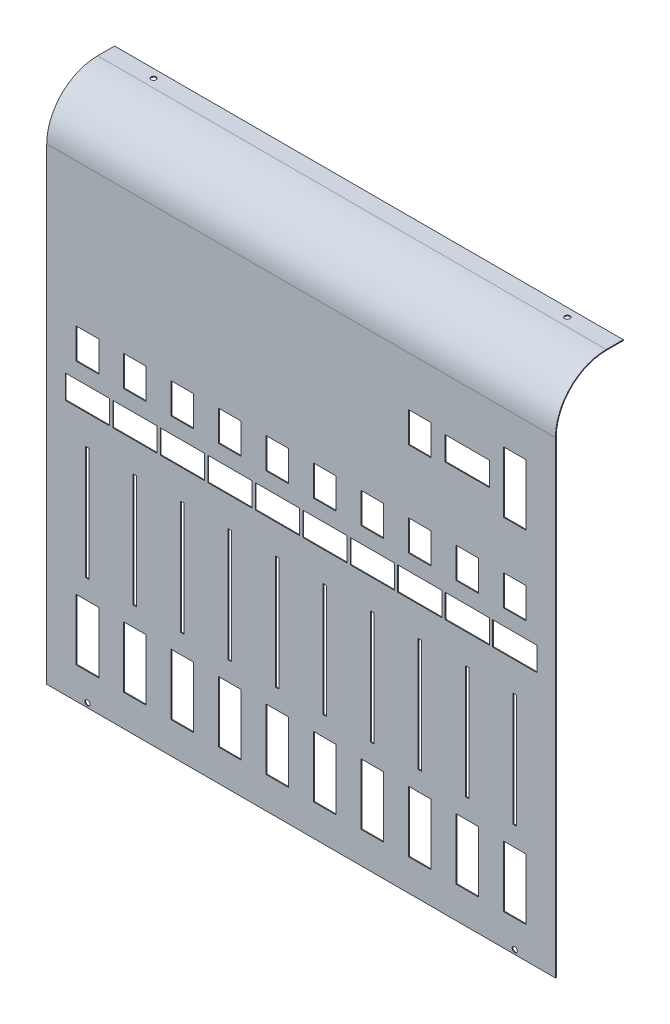
from build123d import *

# Parameters (mm, degrees)
SKETCH1_W           = 300
SKETCH1_H           = 210
SKETCH1_W_2         = 2
SKETCH1_H_2         = 67
SKETCH1_W_3         = 12.35
SKETCH1_H_3         = 17
SKETCH1_H_4         = 35
SKETCH1_W_4         = 25
SKETCH1_H_5         = 13
BOSS_EXTRUDE1_DEPTH = 0.5
SKETCH3_W           = 300
SKETCH3_H           = 66
SKETCH3_W_2         = 25
SKETCH3_H_2         = 13
SKETCH3_W_3         = 12.35
SKETCH3_H_3         = 35
BOSS_EXTRUDE2_DEPTH = 0.5
BOSS_EXTRUDE3_START = -300
BOSS_EXTRUDE3_DEPTH = 300
SKETCH13_W          = 12.35
SKETCH13_H          = 3.584384634
CUT_EXTRUDE4_DEPTH  = 15
SKETCH14_W          = 12.35
SKETCH14_H          = 17
CUT_EXTRUDE5_DEPTH  = 10
SKETCH15_W          = 12.35
SKETCH15_H          = 35
SKETCH15_W_2        = 13.35
SKETCH15_H_2        = 36
CUT_EXTRUDE6_DEPTH  = 10
SKETCH16_W          = 25
SKETCH16_H          = 13
CUT_EXTRUDE7_DEPTH  = 10
SKETCH17_W          = 12.35
SKETCH17_H          = 35
SKETCH17_H_2        = 17
CUT_EXTRUDE8_DEPTH  = 10
SKETCH18_W          = 13
SKETCH18_H          = 7
CUT_EXTRUDE9_DEPTH  = 10
SKETCH19_W          = 25
SKETCH19_H          = 1.257592029
BOSS_EXTRUDE7_DEPTH = 0.5
BOSS_EXTRUDE8_DEPTH = 0.5
CUT_EXTRUDE10_DEPTH = 433
BOSS_EXTRUDE9_DEPTH = 300
CUT_EXTRUDE11_DEPTH = 10
SKETCH24_R          = 1.5
CUT_EXTRUDE12_DEPTH = 10


# Read off the part's stored shape, not the designer's step: Boss-Extrude3
with BuildPart() as part:
    # Sketch1 → Boss-Extrude1 (new body)
    with BuildSketch(Plane.XY):
        with Locations((140, 95)):
            Rectangle(SKETCH1_W, SKETCH1_H)
        with Locations((42, 89.5)):
            Rectangle(SKETCH1_W_2, SKETCH1_H_2, mode=Mode.SUBTRACT)
        with Locations((14.01, 172.725)):
            Rectangle(SKETCH1_W_3, SKETCH1_H_3, mode=Mode.SUBTRACT)
        with Locations((42.01, 172.725)):
            Rectangle(SKETCH1_W_3, SKETCH1_H_3, mode=Mode.SUBTRACT)
        with Locations((70.01, 172.725)):
            Rectangle(SKETCH1_W_3, SKETCH1_H_3, mode=Mode.SUBTRACT)
        with Locations((98.01, 172.725)):
            Rectangle(SKETCH1_W_3, SKETCH1_H_3, mode=Mode.SUBTRACT)
        with Locations((126.01, 172.725)):
            Rectangle(SKETCH1_W_3, SKETCH1_H_3, mode=Mode.SUBTRACT)
        with Locations((154.01, 172.725)):
            Rectangle(SKETCH1_W_3, SKETCH1_H_3, mode=Mode.SUBTRACT)
        with Locations((182.01, 172.725)):
            Rectangle(SKETCH1_W_3, SKETCH1_H_3, mode=Mode.SUBTRACT)
        with Locations((210.01, 172.725)):
            Rectangle(SKETCH1_W_3, SKETCH1_H_3, mode=Mode.SUBTRACT)
        with Locations((238.01, 172.725)):
            Rectangle(SKETCH1_W_3, SKETCH1_H_3, mode=Mode.SUBTRACT)
        with Locations((266.01, 172.725)):
            Rectangle(SKETCH1_W_3, SKETCH1_H_3, mode=Mode.SUBTRACT)
        with Locations((14.01, 26.625)):
            Rectangle(SKETCH1_W_3, SKETCH1_H_4, mode=Mode.SUBTRACT)
        with Locations((42.01, 26.625)):
            Rectangle(SKETCH1_W_3, SKETCH1_H_4, mode=Mode.SUBTRACT)
        with Locations((70.01, 26.625)):
            Rectangle(SKETCH1_W_3, SKETCH1_H_4, mode=Mode.SUBTRACT)
        with Locations((98.01, 26.625)):
            Rectangle(SKETCH1_W_3, SKETCH1_H_4, mode=Mode.SUBTRACT)
        with Locations((126.01, 26.625)):
            Rectangle(SKETCH1_W_3, SKETCH1_H_4, mode=Mode.SUBTRACT)
        with Locations((154.01, 26.625)):
            Rectangle(SKETCH1_W_3, SKETCH1_H_4, mode=Mode.SUBTRACT)
        with Locations((182.01, 26.625)):
            Rectangle(SKETCH1_W_3, SKETCH1_H_4, mode=Mode.SUBTRACT)
        with Locations((210.01, 26.625)):
            Rectangle(SKETCH1_W_3, SKETCH1_H_4, mode=Mode.SUBTRACT)
        with Locations((238.01, 26.625)):
            Rectangle(SKETCH1_W_3, SKETCH1_H_4, mode=Mode.SUBTRACT)
        with Locations((266.01, 26.625)):
            Rectangle(SKETCH1_W_3, SKETCH1_H_4, mode=Mode.SUBTRACT)
        with Locations((14, 89.5)):
            Rectangle(SKETCH1_W_2, SKETCH1_H_2, mode=Mode.SUBTRACT)
        with Locations((70, 89.5)):
            Rectangle(SKETCH1_W_2, SKETCH1_H_2, mode=Mode.SUBTRACT)
        with Locations((98, 89.5)):
            Rectangle(SKETCH1_W_2, SKETCH1_H_2, mode=Mode.SUBTRACT)
        with Locations((126, 89.5)):
            Rectangle(SKETCH1_W_2, SKETCH1_H_2, mode=Mode.SUBTRACT)
        with Locations((154, 89.5)):
            Rectangle(SKETCH1_W_2, SKETCH1_H_2, mode=Mode.SUBTRACT)
        with Locations((182, 89.5)):
            Rectangle(SKETCH1_W_2, SKETCH1_H_2, mode=Mode.SUBTRACT)
        with Locations((210, 89.5)):
            Rectangle(SKETCH1_W_2, SKETCH1_H_2, mode=Mode.SUBTRACT)
        with Locations((238, 89.5)):
            Rectangle(SKETCH1_W_2, SKETCH1_H_2, mode=Mode.SUBTRACT)
        with Locations((266, 89.5)):
            Rectangle(SKETCH1_W_2, SKETCH1_H_2, mode=Mode.SUBTRACT)
        with Locations((14, 147.5)):
            Rectangle(SKETCH1_W_4, SKETCH1_H_5, mode=Mode.SUBTRACT)
        with Locations((42, 147.5)):
            Rectangle(SKETCH1_W_4, SKETCH1_H_5, mode=Mode.SUBTRACT)
        with Locations((70, 147.5)):
            Rectangle(SKETCH1_W_4, SKETCH1_H_5, mode=Mode.SUBTRACT)
        with Locations((98, 147.5)):
            Rectangle(SKETCH1_W_4, SKETCH1_H_5, mode=Mode.SUBTRACT)
        with Locations((126, 147.5)):
            Rectangle(SKETCH1_W_4, SKETCH1_H_5, mode=Mode.SUBTRACT)
        with Locations((154, 147.5)):
            Rectangle(SKETCH1_W_4, SKETCH1_H_5, mode=Mode.SUBTRACT)
        with Locations((182, 147.5)):
            Rectangle(SKETCH1_W_4, SKETCH1_H_5, mode=Mode.SUBTRACT)
        with Locations((210, 147.5)):
            Rectangle(SKETCH1_W_4, SKETCH1_H_5, mode=Mode.SUBTRACT)
        with Locations((238, 147.5)):
            Rectangle(SKETCH1_W_4, SKETCH1_H_5, mode=Mode.SUBTRACT)
        with Locations((266, 147.5)):
            Rectangle(SKETCH1_W_4, SKETCH1_H_5, mode=Mode.SUBTRACT)
    extrude(amount=BOSS_EXTRUDE1_DEPTH)

    # Sketch3 → Boss-Extrude2 (add)
    with BuildSketch(Plane.XY.offset(0.5)):
        with Locations((140, 233)):
            Rectangle(SKETCH3_W, SKETCH3_H)
        with Locations((238, 229.85)):
            Rectangle(SKETCH3_W_2, SKETCH3_H_2, mode=Mode.SUBTRACT)
        with Locations((266, 228)):
            Rectangle(SKETCH3_W_3, SKETCH3_H_3, mode=Mode.SUBTRACT)
    extrude(amount=-BOSS_EXTRUDE2_DEPTH)

    # Boss-Extrude3 outline → Boss-Extrude3 (add)
    with BuildSketch(Plane(origin=(290, 0, 0), x_dir=(0, 0, -1), z_dir=(1, 0, 0)).offset(BOSS_EXTRUDE3_START)):
        with BuildLine():
            ThreePointArc((29.503906843, 296.000342244), (8.288157106, 287.214705752), (-0.5, 266))
            Line((-0.5, 266), (0, 266))
            ThreePointArc((0, 266), (8.331893478, 286.546702239), (28.621157433, 295.487238574))
            ThreePointArc((28.621157433, 295.487238574), (29.057049204, 295.497011647), (29.493037805, 295.500341552))
            ThreePointArc((29.493037805, 295.500341552), (29.496690131, 295.50034223), (29.500342456, 295.500342456))
            Line((29.500342456, 295.500342456), (29.501331505, 295.501324479))
            Line((29.501331505, 295.501324479), (29.752130896, 295.75034235))
            Line((29.752130896, 295.75034235), (29.503906843, 296.000342244))
        make_face()
        with BuildLine():
            ThreePointArc((29.855162644, 295.852642226), (29.694156025, 295.961264134), (29.503906843, 296.000342244))
            Line((29.503906843, 296.000342244), (29.752130896, 295.75034235))
            Line((29.752130896, 295.75034235), (29.855162644, 295.852642226))
        make_face()
        with BuildLine():
            ThreePointArc((29.912937624, 295.910006809), (29.713187706, 295.976752163), (29.503906843, 296.000342244))
            ThreePointArc((29.503906843, 296.000342244), (29.694156025, 295.961264134), (29.855162644, 295.852642226))
            Line((29.855162644, 295.852642226), (29.912937624, 295.910006809))
        make_face()
        with BuildLine():
            Line((29.855162644, 295.852642226), (29.752130896, 295.75034235))
            Line((29.752130896, 295.75034235), (30.000354949, 295.500342456))
            Line((30.000354949, 295.500342456), (29.528548786, 295.500342456))
            ThreePointArc((29.528548786, 295.500342456), (29.704451076, 295.456616738), (29.853553391, 295.353553391))
            ThreePointArc((29.853553391, 295.353553391), (29.962914912, 295.270927945), (30.090809748, 295.221634764))
            Line((30.090809748, 295.221634764), (30.474848123, 295.221634764))
            ThreePointArc((30.474848123, 295.221634764), (30.376441658, 295.479857265), (30.211342813, 295.701453887))
            Line((30.211342813, 295.701453887), (30.202294762, 295.701453887))
            ThreePointArc((30.202294762, 295.701453887), (30.013864766, 295.742920094), (29.855162644, 295.852642226))
        make_face()
        with BuildLine():
            Line((30.000354949, 295.500342456), (29.752130896, 295.75034235))
            Line((29.752130896, 295.75034235), (29.501331505, 295.501324479))
            ThreePointArc((29.501331505, 295.501324479), (29.514946772, 295.50101713), (29.528548786, 295.500342456))
            Line((29.528548786, 295.500342456), (30.000354949, 295.500342456))
        make_face()
        with BuildLine():
            Line((29.912937624, 295.910006809), (29.855162644, 295.852642226))
            ThreePointArc((29.855162644, 295.852642226), (30.013864766, 295.742920094), (30.202294762, 295.701453887))
            Line((30.202294762, 295.701453887), (30.211342813, 295.701453887))
            ThreePointArc((30.211342813, 295.701453887), (30.071675845, 295.819374273), (29.912937624, 295.910006809))
        make_face()
        with BuildLine():
            ThreePointArc((30.500367442, 294.996752781), (30.366426547, 294.495843598), (30.000354949, 294.128635538))
            Line((30.000354949, 294.128635538), (30.000354949, 285))
            Line((30.000354949, 285), (30.500367442, 285))
            Line((30.500367442, 285), (30.500367442, 294.996752781))
        make_face()
        with BuildLine():
            Line((30.000354949, 294.996752781), (30.000354949, 294.128635538))
            ThreePointArc((30.000354949, 294.128635538), (30.366426547, 294.495843598), (30.500367442, 294.996752781))
            ThreePointArc((30.500367442, 294.996752781), (30.493967204, 295.109915432), (30.474848123, 295.221634764))
            Line((30.474848123, 295.221634764), (30.090809748, 295.221634764))
            ThreePointArc((30.090809748, 295.221634764), (29.962914912, 295.270927945), (29.853553391, 295.353553391))
            ThreePointArc((29.853553391, 295.353553391), (29.704451076, 295.456616738), (29.528548786, 295.500342456))
            Line((29.528548786, 295.500342456), (29.500342456, 295.500342456))
            ThreePointArc((29.500342456, 295.500342456), (29.514421337, 295.500045201), (29.528486402, 295.499354419))
            ThreePointArc((29.528486402, 295.499354419), (29.863901447, 295.341451321), (30.000354949, 294.996752781))
        make_face()
    extrude(amount=BOSS_EXTRUDE3_DEPTH)

    # Sketch13 → Cut-Extrude4 (cut)
    with BuildSketch(Plane.XY.offset(0.5)):
        Polygon((216.175, 232.915615366), (203.825, 232.915615366), (203.825, 219.5), (216.175, 219.5), (216.175, 228), align=None)
        with Locations((210, 234.707807683)):
            Rectangle(SKETCH13_W, SKETCH13_H)
    extrude(amount=-CUT_EXTRUDE4_DEPTH, mode=Mode.SUBTRACT)

    # Sketch14 → Cut-Extrude5 (cut)
    # profile 1 of 10: a face of its own
    with BuildSketch(Plane.XY.offset(0.5)):
        Polygon((20.685, 181.725), (7.835, 181.725), (7.335, 181.725), (7.335, 163.725), (20.685, 163.725), align=None)
        with Locations((14.01, 172.725)):
            Rectangle(SKETCH14_W, SKETCH14_H, mode=Mode.SUBTRACT)
    # profile 2 of 10: a face of its own
    with BuildSketch(Plane.XY.offset(0.5)):
        Polygon((48.685, 181.725), (35.835, 181.725), (35.335, 181.725), (35.335, 163.725), (48.685, 163.725), align=None)
        with Locations((42.01, 172.725)):
            Rectangle(SKETCH14_W, SKETCH14_H, mode=Mode.SUBTRACT)
    # profile 3 of 10: a face of its own
    with BuildSketch(Plane.XY.offset(0.5)):
        Polygon((76.685, 181.725), (63.835, 181.725), (63.335, 181.725), (63.335, 163.725), (76.685, 163.725), align=None)
        with Locations((70.01, 172.725)):
            Rectangle(SKETCH14_W, SKETCH14_H, mode=Mode.SUBTRACT)
    # profile 4 of 10: a face of its own
    with BuildSketch(Plane.XY.offset(0.5)):
        Polygon((104.685, 181.725), (91.835, 181.725), (91.335, 181.725), (91.335, 163.725), (104.685, 163.725), align=None)
        with Locations((98.01, 172.725)):
            Rectangle(SKETCH14_W, SKETCH14_H, mode=Mode.SUBTRACT)
    # profile 5 of 10: a face of its own
    with BuildSketch(Plane.XY.offset(0.5)):
        Polygon((132.685, 181.725), (119.835, 181.725), (119.335, 181.725), (119.335, 163.725), (132.685, 163.725), align=None)
        with Locations((126.01, 172.725)):
            Rectangle(SKETCH14_W, SKETCH14_H, mode=Mode.SUBTRACT)
    # profile 6 of 10: a face of its own
    with BuildSketch(Plane.XY.offset(0.5)):
        Polygon((160.685, 181.725), (147.835, 181.725), (147.335, 181.725), (147.335, 163.725), (160.685, 163.725), align=None)
        with Locations((154.01, 172.725)):
            Rectangle(SKETCH14_W, SKETCH14_H, mode=Mode.SUBTRACT)
    # profile 7 of 10: a face of its own
    with BuildSketch(Plane.XY.offset(0.5)):
        Polygon((188.685, 181.725), (175.835, 181.725), (175.335, 181.725), (175.335, 163.725), (188.685, 163.725), align=None)
        with Locations((182.01, 172.725)):
            Rectangle(SKETCH14_W, SKETCH14_H, mode=Mode.SUBTRACT)
    # profile 8 of 10: a face of its own
    with BuildSketch(Plane.XY.offset(0.5)):
        Polygon((216.685, 181.725), (203.835, 181.725), (203.335, 181.725), (203.335, 163.725), (216.685, 163.725), align=None)
        with Locations((210.01, 172.725)):
            Rectangle(SKETCH14_W, SKETCH14_H, mode=Mode.SUBTRACT)
    # profile 9 of 10: a face of its own
    with BuildSketch(Plane.XY.offset(0.5)):
        Polygon((244.685, 181.725), (231.835, 181.725), (231.335, 181.725), (231.335, 163.725), (244.685, 163.725), align=None)
        with Locations((238.01, 172.725)):
            Rectangle(SKETCH14_W, SKETCH14_H, mode=Mode.SUBTRACT)
    # profile 10 of 10: a face of its own
    with BuildSketch(Plane.XY.offset(0.5)):
        Polygon((272.685, 181.725), (259.835, 181.725), (259.335, 181.725), (259.335, 163.725), (272.685, 163.725), align=None)
        with Locations((266.01, 172.725)):
            Rectangle(SKETCH14_W, SKETCH14_H, mode=Mode.SUBTRACT)
    extrude(amount=-CUT_EXTRUDE5_DEPTH, mode=Mode.SUBTRACT)

    # Sketch15 → Cut-Extrude6 (cut)
    # profile 1 of 10: a face of its own
    with BuildSketch(Plane.XY.offset(0.5)):
        Polygon((20.685, 44.625), (7.835, 44.625), (7.335, 44.625), (7.335, 8.625), (20.685, 8.625), align=None)
        with Locations((14.01, 26.625)):
            Rectangle(SKETCH15_W, SKETCH15_H, mode=Mode.SUBTRACT)
    # profile 2 of 10: a face of its own
    with BuildSketch(Plane.XY.offset(0.5)):
        with Locations((42.01, 26.625)):
            Rectangle(SKETCH15_W_2, SKETCH15_H_2)
        with Locations((42.01, 26.625)):
            Rectangle(SKETCH15_W, SKETCH15_H, mode=Mode.SUBTRACT)
    # profile 3 of 10: a face of its own
    with BuildSketch(Plane.XY.offset(0.5)):
        with Locations((70.01, 26.625)):
            Rectangle(SKETCH15_W_2, SKETCH15_H_2)
        with Locations((70.01, 26.625)):
            Rectangle(SKETCH15_W, SKETCH15_H, mode=Mode.SUBTRACT)
    # profile 4 of 10: a face of its own
    with BuildSketch(Plane.XY.offset(0.5)):
        with Locations((98.01, 26.625)):
            Rectangle(SKETCH15_W_2, SKETCH15_H_2)
        with Locations((98.01, 26.625)):
            Rectangle(SKETCH15_W, SKETCH15_H, mode=Mode.SUBTRACT)
    # profile 5 of 10: a face of its own
    with BuildSketch(Plane.XY.offset(0.5)):
        with Locations((126.01, 26.625)):
            Rectangle(SKETCH15_W_2, SKETCH15_H_2)
        with Locations((126.01, 26.625)):
            Rectangle(SKETCH15_W, SKETCH15_H, mode=Mode.SUBTRACT)
    # profile 6 of 10: a face of its own
    with BuildSketch(Plane.XY.offset(0.5)):
        with Locations((154.01, 26.625)):
            Rectangle(SKETCH15_W_2, SKETCH15_H_2)
        with Locations((154.01, 26.625)):
            Rectangle(SKETCH15_W, SKETCH15_H, mode=Mode.SUBTRACT)
    # profile 7 of 10: a face of its own
    with BuildSketch(Plane.XY.offset(0.5)):
        with Locations((182.01, 26.625)):
            Rectangle(SKETCH15_W_2, SKETCH15_H_2)
        with Locations((182.01, 26.625)):
            Rectangle(SKETCH15_W, SKETCH15_H, mode=Mode.SUBTRACT)
    # profile 8 of 10: a face of its own
    with BuildSketch(Plane.XY.offset(0.5)):
        with Locations((210.01, 26.625)):
            Rectangle(SKETCH15_W_2, SKETCH15_H_2)
        with Locations((210.01, 26.625)):
            Rectangle(SKETCH15_W, SKETCH15_H, mode=Mode.SUBTRACT)
    # profile 9 of 10: a face of its own
    with BuildSketch(Plane.XY.offset(0.5)):
        with Locations((238.01, 26.625)):
            Rectangle(SKETCH15_W_2, SKETCH15_H_2)
        with Locations((238.01, 26.625)):
            Rectangle(SKETCH15_W, SKETCH15_H, mode=Mode.SUBTRACT)
    # profile 10 of 10: a face of its own
    with BuildSketch(Plane.XY.offset(0.5)):
        with Locations((266.01, 26.625)):
            Rectangle(SKETCH15_W_2, SKETCH15_H_2)
        with Locations((266.01, 26.625)):
            Rectangle(SKETCH15_W, SKETCH15_H, mode=Mode.SUBTRACT)
    extrude(amount=-CUT_EXTRUDE6_DEPTH, mode=Mode.SUBTRACT)

    # Sketch16 → Cut-Extrude7 (cut)
    # profile 1 of 10: a face of its own
    with BuildSketch(Plane.XY.offset(0.5)):
        Polygon((27, 154.5), (1.5, 154.5), (1, 154.5), (1, 140.5), (27, 140.5), align=None)
        with Locations((14, 147.5)):
            Rectangle(SKETCH16_W, SKETCH16_H, mode=Mode.SUBTRACT)
    # profile 2 of 10: a face of its own
    with BuildSketch(Plane.XY.offset(0.5)):
        Polygon((55, 154.5), (29.5, 154.5), (29, 154.5), (29, 140.5), (55, 140.5), align=None)
        with Locations((42, 147.5)):
            Rectangle(SKETCH16_W, SKETCH16_H, mode=Mode.SUBTRACT)
    # profile 3 of 10: a face of its own
    with BuildSketch(Plane.XY.offset(0.5)):
        Polygon((83, 154.5), (57.5, 154.5), (57, 154.5), (57, 140.5), (83, 140.5), align=None)
        with Locations((70, 147.5)):
            Rectangle(SKETCH16_W, SKETCH16_H, mode=Mode.SUBTRACT)
    # profile 4 of 10: a face of its own
    with BuildSketch(Plane.XY.offset(0.5)):
        Polygon((111, 154.5), (85.5, 154.5), (85, 154.5), (85, 140.5), (111, 140.5), align=None)
        with Locations((98, 147.5)):
            Rectangle(SKETCH16_W, SKETCH16_H, mode=Mode.SUBTRACT)
    # profile 5 of 10: a face of its own
    with BuildSketch(Plane.XY.offset(0.5)):
        Polygon((139, 154.5), (113.5, 154.5), (113, 154.5), (113, 140.5), (139, 140.5), align=None)
        with Locations((126, 147.5)):
            Rectangle(SKETCH16_W, SKETCH16_H, mode=Mode.SUBTRACT)
    # profile 6 of 10: a face of its own
    with BuildSketch(Plane.XY.offset(0.5)):
        Polygon((167, 154.5), (141.5, 154.5), (141, 154.5), (141, 140.5), (167, 140.5), align=None)
        with Locations((154, 147.5)):
            Rectangle(SKETCH16_W, SKETCH16_H, mode=Mode.SUBTRACT)
    # profile 7 of 10: a face of its own
    with BuildSketch(Plane.XY.offset(0.5)):
        Polygon((195, 154.5), (169.5, 154.5), (169, 154.5), (169, 140.5), (195, 140.5), align=None)
        with Locations((182, 147.5)):
            Rectangle(SKETCH16_W, SKETCH16_H, mode=Mode.SUBTRACT)
    # profile 8 of 10: a face of its own
    with BuildSketch(Plane.XY.offset(0.5)):
        Polygon((223, 154.5), (197.5, 154.5), (197, 154.5), (197, 140.5), (223, 140.5), align=None)
        with Locations((210, 147.5)):
            Rectangle(SKETCH16_W, SKETCH16_H, mode=Mode.SUBTRACT)
    # profile 9 of 10: a face of its own
    with BuildSketch(Plane.XY.offset(0.5)):
        Polygon((251, 154.5), (225.5, 154.5), (225, 154.5), (225, 140.5), (251, 140.5), align=None)
        with Locations((238, 147.5)):
            Rectangle(SKETCH16_W, SKETCH16_H, mode=Mode.SUBTRACT)
    # profile 10 of 10: a face of its own
    with BuildSketch(Plane.XY.offset(0.5)):
        Polygon((279, 154.5), (253.5, 154.5), (253, 154.5), (253, 140.5), (279, 140.5), align=None)
        with Locations((266, 147.5)):
            Rectangle(SKETCH16_W, SKETCH16_H, mode=Mode.SUBTRACT)
    extrude(amount=-CUT_EXTRUDE7_DEPTH, mode=Mode.SUBTRACT)

    # Sketch17 → Cut-Extrude8 (cut)
    # profile 1 of 2: a face of its own
    with BuildSketch(Plane.XY.offset(0.5)):
        Polygon((272.675, 246), (259.825, 246), (259.325, 246), (259.325, 210), (272.675, 210), align=None)
        with Locations((266, 228)):
            Rectangle(SKETCH17_W, SKETCH17_H, mode=Mode.SUBTRACT)
    # profile 2 of 2: a face of its own
    with BuildSketch(Plane.XY.offset(0.5)):
        Polygon((216.675, 237), (203.825, 237), (203.325, 237), (203.325, 219), (216.675, 219), align=None)
        with Locations((210, 228)):
            Rectangle(SKETCH17_W, SKETCH17_H_2, mode=Mode.SUBTRACT)
    extrude(amount=-CUT_EXTRUDE8_DEPTH, mode=Mode.SUBTRACT)

    # Sketch18 → Cut-Extrude9 (cut)
    with BuildSketch(Plane.XY.offset(0.5)):
        Polygon((225, 235), (225, 228), (238, 228), (250.5, 228), (251, 228), (251, 235), align=None)
        with Locations((231.5, 224.5)):
            Rectangle(SKETCH18_W, SKETCH18_H)
        Polygon((238, 223.35), (238, 221), (251, 221), (251, 228), (250.5, 228), (250.5, 223.35), align=None)
    extrude(amount=-CUT_EXTRUDE9_DEPTH, mode=Mode.SUBTRACT)

    # Sketch19 → Boss-Extrude7 (add)
    with BuildSketch(Plane.XY.offset(0.5)):
        with Locations((238, 235.628796015)):
            Rectangle(SKETCH19_W, SKETCH19_H)
    extrude(amount=-BOSS_EXTRUDE7_DEPTH)

    # Sketch20 → Boss-Extrude8 (add)
    with BuildSketch(Plane.XY.offset(0.5)):
        Polygon((224.437375883, 237.361007254), (251.612410637, 237.668818311), (251.632752312, 235.872957809), (224.457717557, 235.565146752), align=None)
    extrude(amount=-BOSS_EXTRUDE8_DEPTH)

    # Sketch21 → Cut-Extrude10 (cut)
    with BuildSketch(Plane(origin=(290, 0, 0), x_dir=(0, 0, -1), z_dir=(1, 0, 0))):
        Polygon((29.528517594, 295.499848438), (37.574928663, 295.499848438), (42.317114711, 278.35199698), (16.192205022, 276.334815178), align=None)
    extrude(amount=-CUT_EXTRUDE10_DEPTH, mode=Mode.SUBTRACT)

    # Sketch22 → Boss-Extrude9 (add)
    with BuildSketch(Plane(origin=(290, 0, 0), x_dir=(0, 0, -1), z_dir=(1, 0, 0))):
        Polygon((29.501331505, 295.501324479), (39.501331396, 295.499848438), (39.501331396, 295.999848438), (29.500342456, 296.000342456), align=None)
    extrude(amount=-BOSS_EXTRUDE9_DEPTH)

    # Sketch23 → Cut-Extrude11 (cut)
    with BuildSketch(Plane.XY.offset(0.5)):
        with BuildLine():
            ThreePointArc((13.99, -6), (12.49, -7.5), (13.99, -9))
            Line((13.99, -9), (13.99, -7.5))
            Line((13.99, -7.5), (13.99, -6))
        make_face()
        with BuildLine():
            Line((13.99, -7.5), (13.99, -9))
            ThreePointArc((13.99, -9), (15.050660172, -8.560660172), (15.49, -7.5))
            ThreePointArc((15.49, -7.5), (15.050660172, -6.439339828), (13.99, -6))
            Line((13.99, -6), (13.99, -7.5))
        make_face()
        with BuildLine():
            ThreePointArc((267.51, -7.5), (267.070660172, -6.439339828), (266.01, -6))
            Line((266.01, -6), (266.01, -7.5))
            Line((266.01, -7.5), (266.01, -9))
            ThreePointArc((266.01, -9), (267.070660172, -8.560660172), (267.51, -7.5))
        make_face()
        with BuildLine():
            Line((266.01, -7.5), (266.01, -6))
            ThreePointArc((266.01, -6), (264.51, -7.5), (266.01, -9))
            Line((266.01, -9), (266.01, -7.5))
        make_face()
    extrude(amount=-CUT_EXTRUDE11_DEPTH, mode=Mode.SUBTRACT)

    # Sketch24 → Cut-Extrude12 (cut)
    with BuildSketch(Plane(origin=(0, 296.001798961, -0.014621586), x_dir=(1, 0, 0), z_dir=(0, 0.9999999987799706, -4.939695126755589e-05))):
        with Locations(Location((18, 34.487997575, 0), (0, 0, 270))):
            Circle(SKETCH24_R)
        with Locations(Location((262, 34.487997575, 0), (0, 0, 270))):
            Circle(SKETCH24_R)
    extrude(amount=-CUT_EXTRUDE12_DEPTH, mode=Mode.SUBTRACT)


solid = part.part
